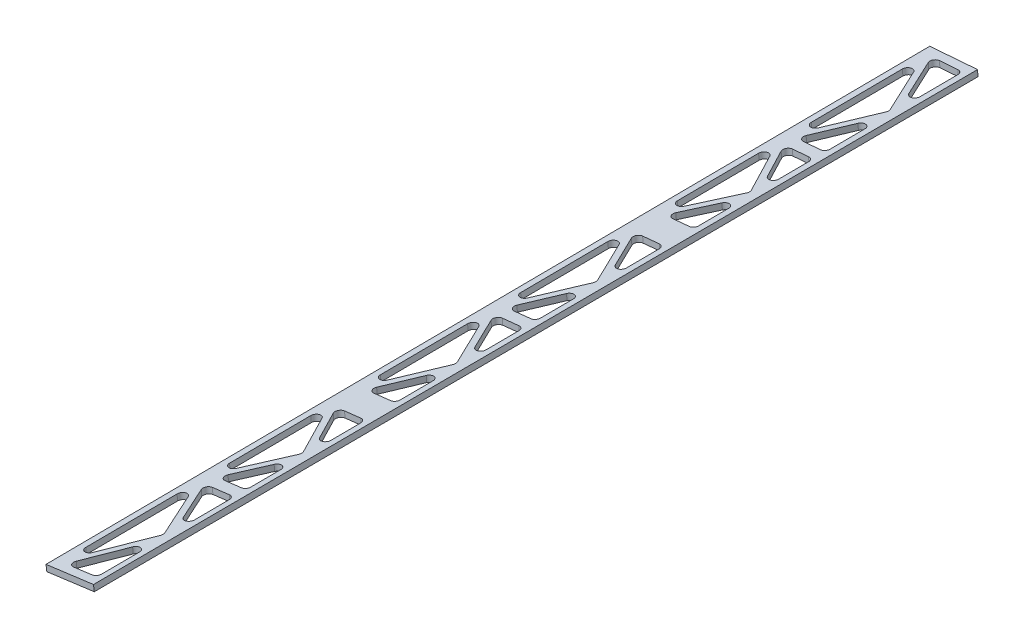
from build123d import *

# Parameters (mm, degrees)
CUT_EXTRUDE1_DEPTH = 580.658518936
FILLET1_R          = 2.54


with BuildPart() as part:
    # Loft3: read off the stored shape, not the designer's step
    # Loft3: loft between two sections, ruled curve by curve
    loft3_from = [
        Edge.make_bspline([(315.158704756, 5.303615051, 0), (319.355142138, 5.861310678, 0), (323.551579519, 6.419006306, 0), (331.944454283, 7.534397562, 0), (336.140891664, 8.09209319, 0), (340.337329046, 8.649788818, 0)], [0, 0, 0, 0, 0.5, 0.5, 1, 1, 1, 1], 3),
        Edge.make_bspline([(340.337329046, 8.649788818, 0), (340.407355182, 8.125276312, 0), (340.477381317, 7.600763807, 0), (340.617433589, 6.551738796, 0), (340.687459724, 6.02722629, 0), (340.75748586, 5.502713785, 0)], [0, 0, 0, 0, 0.5, 0.5, 1, 1, 1, 1], 3),
        Edge.make_bspline([(315.580892501, 2.156809924, 0), (315.510527877, 2.681277445, 0), (315.440163253, 3.205744966, 0), (315.299434005, 4.254680008, 0), (315.22906938, 4.779147529, 0), (315.158704756, 5.303615051, 0)], [0, 0, 0, 0, 0.5, 0.5, 1, 1, 1, 1], 3),
        Edge.make_bspline([(340.75748586, 5.502713785, 0), (336.561386967, 4.945063141, 0), (332.365288074, 4.387412498, 0), (323.973090288, 3.272111211, 0), (319.776991394, 2.714460567, 0), (315.580892501, 2.156809924, 0)], [0, 0, 0, 0, 0.5, 0.5, 1, 1, 1, 1], 3),
    ]
    loft3_to = [
        Edge.make_bspline([(314.473134842, 8.243392136, -469.138), (318.694057427, 8.567311334, -469.138), (322.914980012, 8.891230531, -469.138), (331.356825181, 9.539068926, -469.138), (335.577747765, 9.862988123, -469.138), (339.79867035, 10.18690732, -469.138)], [0, 0, 0, 0, 0.5, 0.5, 1, 1, 1, 1], 3),
        Edge.make_bspline([(339.79867035, 10.18690732, -469.138), (339.839160249, 9.659291997, -469.138), (339.879650149, 9.131676674, -469.138), (339.960629948, 8.076446028, -469.138), (340.001119848, 7.548830705, -469.138), (340.041609748, 7.021215382, -469.138)], [0, 0, 0, 0, 0.5, 0.5, 1, 1, 1, 1], 3),
        Edge.make_bspline([(314.845201268, 5.090268039, -469.138), (314.783190197, 5.615788722, -469.138), (314.721179126, 6.141309405, -469.138), (314.597156984, 7.192350771, -469.138), (314.535145913, 7.717871454, -469.138), (314.473134842, 8.243392136, -469.138)], [0, 0, 0, 0, 0.5, 0.5, 1, 1, 1, 1], 3),
        Edge.make_bspline([(340.041609748, 7.021215382, -469.138), (335.842208336, 6.699390825, -469.138), (331.642806923, 6.377566268, -469.138), (323.244004099, 5.733917154, -469.138), (319.044602687, 5.412092597, -469.138), (314.845201268, 5.090268039, -469.138)], [0, 0, 0, 0, 0.5, 0.5, 1, 1, 1, 1], 3),
    ]
    loft3 = Solid(Shell([*[Face.make_surface_from_curves(loft3_from[k], loft3_to[k]) for k in range(4)], Face(Wire(loft3_from)), Face(Wire(loft3_to))]))
    add(loft3)

    # Sketch4 → Cut-Extrude1 (cut, through all)
    with BuildSketch(Plane(origin=(1.332665476, -17.365682096, -0.058428358), x_dir=(-0.9970683600997042, -0.07651548216647033, -0.00025744304054922207), z_dir=(0.0765159152600723, -0.997062716516588, -0.0033547048269242895))):
        Polygon((-320.531874327, 4.771164632), (-336.945731148, 38.429012957), (-336.997269264, 4.771164632), align=None)
        Polygon((-317.986641593, 6.795469101), (-317.89207581, 77.232360164), (-335.172834957, 42.037051616), align=None)
        Polygon((-321.214672187, 77.669164632), (-336.885645207, 77.669164632), (-336.934670097, 45.652621137), align=None)
        Polygon((-317.88277073, 84.163206853), (-317.798075419, 147.248122412), (-335.019682735, 115.728728827), align=None)
        Polygon((-321.417296249, 84.019164632), (-336.832443784, 112.41326376), (-336.875921857, 84.019164632), align=None)
        Polygon((-336.82227931, 119.051347317), (-321.337386636, 147.392164632), (-336.778882824, 147.392164632), align=None)
        Polygon((-321.173206507, 163.267164632), (-336.707723094, 193.864243142), (-336.754574449, 163.267164632), align=None)
        Polygon((-317.776135995, 163.589602368), (-317.685525754, 231.080226897), (-334.920767197, 197.357993161), align=None)
        Polygon((-321.086379604, 231.402664632), (-336.650242904, 231.402664632), (-336.697012289, 200.8591178), align=None)
        Polygon((-321.071561987, 237.752664632), (-336.593666685, 268.350732133), (-336.640519554, 237.752664632), align=None)
        Polygon((-317.676131615, 238.077408328), (-317.585518673, 305.570044717), (-334.807011694, 271.846786591), align=None)
        Polygon((-336.582948817, 275.350218713), (-320.984720083, 305.894788412), (-336.536177866, 305.894788412), align=None)
        Polygon((-336.511869491, 321.769788412), (-321.093049921, 321.769788412), (-336.468400788, 350.157768652), align=None)
        Polygon((-317.563568012, 321.919894124), (-317.478888982, 384.992682701), (-334.656606594, 353.479293693), align=None)
        Polygon((-336.458217745, 356.807979192), (-321.013120702, 385.142788412), (-336.414830459, 385.142788412), align=None)
        Polygon((-336.405107109, 391.492788412), (-320.781749266, 391.492788412), (-336.356017101, 423.55185767), align=None)
        Polygon((-334.584407521, 427.171079588), (-317.469560737, 391.940784064), (-317.375025004, 462.35529276), align=None)
        Polygon((-336.344921778, 430.797848224), (-319.913866329, 464.390788412), (-336.293483051, 464.390788412), align=None)
    extrude(amount=CUT_EXTRUDE1_DEPTH, mode=Mode.SUBTRACT)

    # Fillet1
    fillet1_edges = [part.edges().sort_by_distance(p)[0] for p in [
        (337.229983442, 7.256751361, -163.243672783),
        (321.73749953, 5.501539346, -163.249578348),
        (337.182431135, 7.367036235, -193.840553415),
        (337.353130824, 6.971310238, -83.996184615),
        (321.993801262, 5.0851242, -84.002530853),
        (337.309010407, 7.073548566, -112.390100469),
        (336.875207256, 8.080421109, -391.467817059),
        (321.308609297, 6.742203253, -391.47231961),
        (336.825356645, 8.196316472, -423.526677837),
        (318.141272938, 5.954135568, -305.551741096),
        (335.288324571, 7.470523942, -271.823190068),
        (318.245127665, 5.5579728, -238.06005561),
        (336.983611184, 7.828533146, -321.745269911),
        (321.630569326, 6.380642537, -321.750141466),
        (336.939476209, 7.93106304, -350.133065862),
        (337.423965456, 6.807232717, -38.406326942),
        (336.76184839, 8.344020586, -464.365342773),
        (336.814088903, 8.222517748, -430.772621249),
        (320.430894444, 7.082339197, -464.36958781),
        (337.008290897, 7.771213145, -305.870372913),
        (337.0557738, 7.66095852, -275.326001287),
        (321.525417809, 6.281663451, -305.875384634),
        (337.066654348, 7.635699058, -268.326560076),
        (337.114216319, 7.525304718, -237.728690815),
        (321.623549686, 5.908604593, -237.734130345),
        (336.885080825, 8.057471154, -385.117858333),
        (336.929136669, 7.955087254, -356.783233212),
        (321.540213815, 6.726665749, -385.122335945),
        (318.116113914, 6.050112247, -321.901360125),
        (318.019055837, 6.420389334, -384.973259878),
        (335.134791353, 7.780181355, -353.455117358),
        (318.008363706, 6.461181793, -391.921263319),
        (317.900003548, 6.874617359, -462.334779536),
        (335.059504949, 8.065586545, -427.146360093),
        (337.362997433, 6.948450992, -77.646225584),
        (337.412742439, 6.833223809, -45.629888561),
        (321.793586897, 5.024595617, -77.652698564),
        (318.600984513, 4.200800234, -6.781373604),
        (318.492613226, 4.614063418, -77.217272895),
        (335.663013773, 6.595799284, -42.01509741),
        (318.481949481, 4.654730686, -84.148021985),
        (318.384885632, 5.024910999, -147.232049114),
        (335.507265742, 6.871697559, -115.706263447),
        (318.35974171, 5.120809574, -163.573298907),
        (318.255894399, 5.516904233, -231.062972752),
        (335.405007202, 7.18611693, -197.334931928),
        (337.124086411, 7.502400092, -231.378731938),
        (337.171559614, 7.392254847, -200.835382816),
        (321.639385303, 5.874541959, -231.384209009),
        (337.254654184, 7.19954826, -147.368775392),
        (337.298695349, 7.097455649, -119.028141161),
        (321.90346796, 5.431114229, -147.374725443),
        (337.476255789, 6.686161235, -4.748695463),
        (321.128455658, 4.522954648, -4.755973761),
    ]]
    fillet(fillet1_edges, radius=FILLET1_R)


solid = part.part
